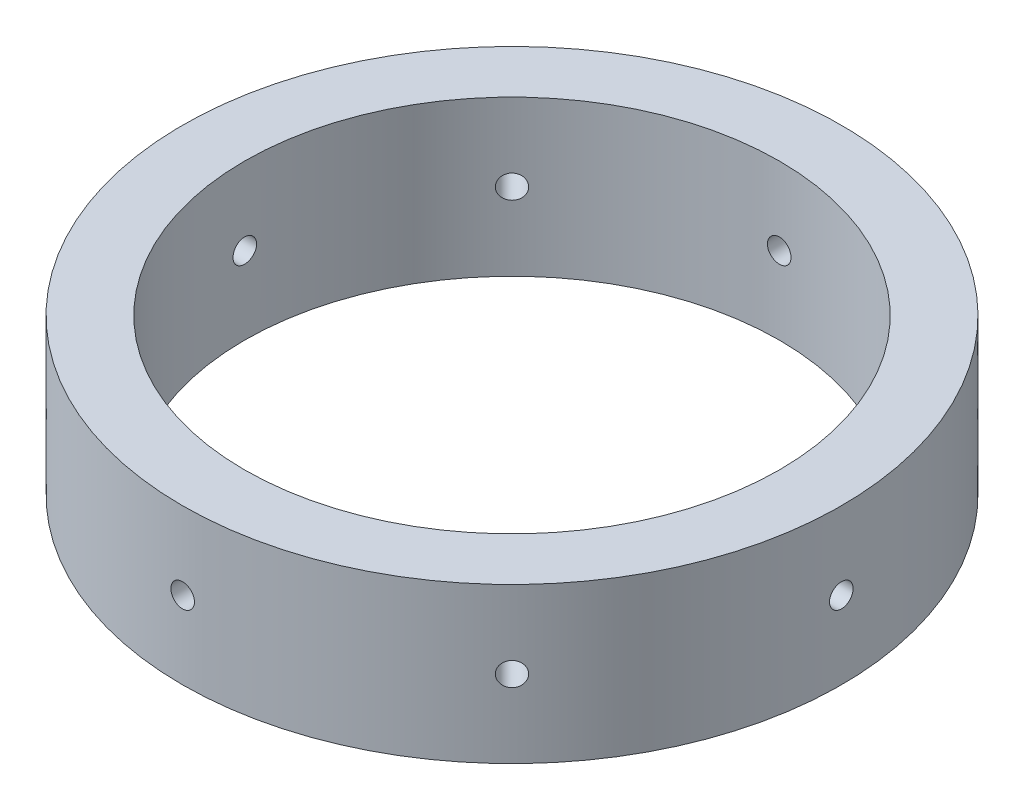
from build123d import *

# Parameters (mm, degrees)
SKETCH3_R           = 53.1
SKETCH3_R_2         = 43.1
BOSS_EXTRUDE1_DEPTH = 25
CUT_EXTRUDE1_REACH  = 123.339
SKETCH5_R           = 1.9
CIRPATTERN1_COUNT   = 8


with BuildPart() as part:
    # Sketch3 → Boss-Extrude1 (new body)
    with BuildSketch(Plane(origin=(0, 0, 0), x_dir=(1, 0, 0), z_dir=(0, 1, 0))):
        Circle(SKETCH3_R)
        Circle(SKETCH3_R_2, mode=Mode.SUBTRACT)
    extrude(amount=BOSS_EXTRUDE1_DEPTH)

    # Sketch5 → Cut-Extrude1 (cut, up to next)
    with BuildSketch(Plane(origin=(53.1, 0, 0), x_dir=(0, 0, -1), z_dir=(1, 0, 0)), mode=Mode.PRIVATE) as cut_extrude1_sk1:
        with Locations((0, 12.5)):
            Circle(SKETCH5_R)
    cut_extrude1_tool1 = extrude(cut_extrude1_sk1.sketch, amount=-CUT_EXTRUDE1_REACH, mode=Mode.PRIVATE) & part.part
    cut_extrude1 = cut_extrude1_tool1.solids().sort_by_distance((53.1, 12.5, 0))[0]
    add(cut_extrude1, mode=Mode.SUBTRACT)

    # CirPattern1: Cut-Extrude1 ×8 about axis
    cirpattern1_axis = Axis((0, 25, 0), (0, -1, 0))
    for i in range(1, CIRPATTERN1_COUNT):
        add(cut_extrude1.rotate(cirpattern1_axis, i * 360 / CIRPATTERN1_COUNT), mode=Mode.SUBTRACT)


solid = part.part
